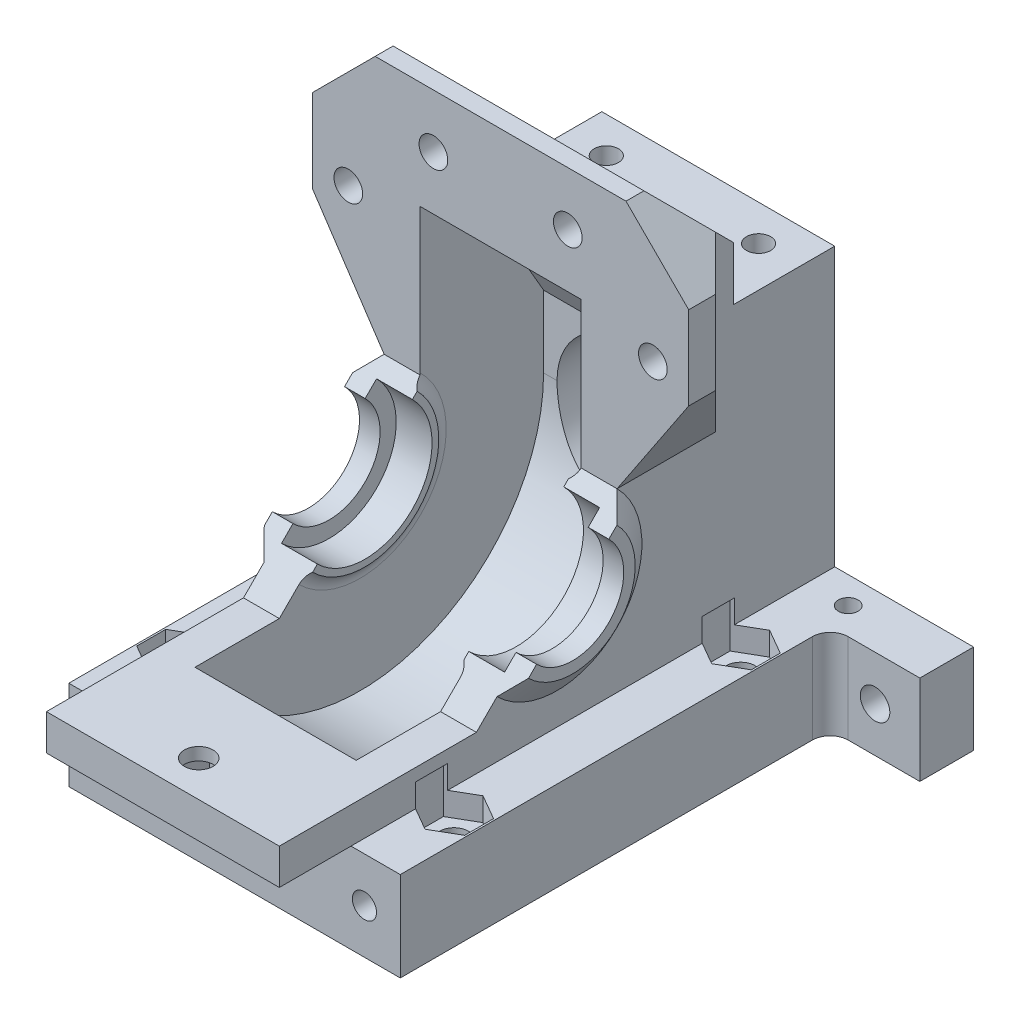
from build123d import *

# Parameters (mm, degrees)
ESQUISSE1_R                          = 1.1
ESQUISSE1_R_2                        = 1.6
BOSS_EXTRU_1_DEPTH                   = 10
BOSS_EXTRU_2_DEPTH                   = 13
BOSS_EXTRU_2_DEPTH_BACK              = 13
BOSS_EXTRU_3_DEPTH                   = 1.75
BOSS_EXTRU_7_DEPTH                   = 11
CHANFREIN2_SIZE                      = 8
ESQUISSE6_R                          = 1.6
ESQUISSE6_R_2                        = 1.65
ENL_V_MAT_EXTRU_3_DEPTH              = 52
ENL_V_MAT_EXTRU_17_DEPTH             = 21.3
ESQUISSE31_R                         = 1.35
ENL_V_MAT_EXTRU_16_DEPTH             = 10
ENL_V_MAT_EXTRU_5_DEPTH              = 2.6
ESQUISSE13_R                         = 1.35
ENL_V_MAT_EXTRU_6_DEPTH              = 8
ENL_V_MAT_EXTRU_7_DEPTH              = 9
ENL_V_MAT_EXTRU_7_DEPTH_BACK         = 9
BOSS_EXTRU_5_REACH                   = 61.593
ENL_V_MAT_EXTRU_8_DEPTH              = 4
CONG_1_R                             = 2
ENL_V_MAT_EXTRU_10_REACH             = 65.853
ESQUISSE21_R                         = 1.6
ENL_V_MAT_EXTRU_11_DEPTH             = 2.6
ESQUISSE30_R                         = 6
ESQUISSE30_R_2                       = 3.5
BOSS_EXTRU_6_DEPTH                   = 3.5
CONG_2_R                             = 3.5
ENL_V_MAT_EXTRU_12_REACH             = 78.689
ESQUISSE25_R                         = 5.1
ENL_V_MAT_EXTRU_12_DIRECTION_2_DEPTH = 2.5
ESQUISSE26_R                         = 7.5
ENL_V_MAT_EXTRU_13_DEPTH             = 5
ENL_V_MAT_EXTRU_13_DIRECTION_2_REACH = 70.48
CHANFREIN3_SIZE2                     = 2.5
CHANFREIN3_SIZE                      = 1.75
CHANFREIN4_SIZE2                     = 1.75
CHANFREIN4_SIZE                      = 2.5
CHANFREIN5_SIZE                      = 10


# Some blends are built 0.0001 mm under size
with BuildPart() as part:
    # Esquisse1 → Boss.-Extru.1 (new body)
    with BuildSketch(Plane(origin=(0, -23, 0), x_dir=(1, 0, 0), z_dir=(0, 1, 0))):
        Polygon((18.5, -23), (-18.5, -23), (-18.5, 25), (-28.5, 25), (-28.5, 31), (28.5, 31), (28.5, 25), (18.5, 25), align=None)
        with Locations(Location((-17.5, 28, 0), (0, 0, 270))):
            Circle(ESQUISSE1_R, mode=Mode.SUBTRACT)
        with Locations(Location((-15.5, 18, 0), (0, 0, 270))):
            Circle(ESQUISSE1_R_2, mode=Mode.SUBTRACT)
        with Locations(Location((-15.5, -14, 0), (0, 0, 270))):
            Circle(ESQUISSE1_R_2, mode=Mode.SUBTRACT)
        with Locations(Location((15.5, -14, 0), (0, 0, 90))):
            Circle(ESQUISSE1_R_2, mode=Mode.SUBTRACT)
        with Locations(Location((15.5, 18, 0), (0, 0, 90))):
            Circle(ESQUISSE1_R_2, mode=Mode.SUBTRACT)
        with Locations(Location((17.5, 28, 0), (0, 0, 90))):
            Circle(ESQUISSE1_R, mode=Mode.SUBTRACT)
    extrude(amount=BOSS_EXTRU_1_DEPTH)

    # Esquisse2 → Boss.-Extru.2 (add, two sides: drawn at the far end of the back side and taken through both)
    with BuildSketch(Plane(origin=(0, 0, 0), x_dir=(0, 0, -1), z_dir=(1, 0, 0)).offset(-BOSS_EXTRU_2_DEPTH_BACK)):
        with BuildLine():
            Line((31, -13), (-31, -13))
            Line((-31, -13), (-31, -9))
            Line((-31, -9), (-9, -9))
            Line((-9, -9), (-4.030508653, -4.030508653))
            ThreePointArc((-4.030508653, -4.030508653), (4.030508653, -4.030508653), (4.030508653, 4.030508653))
            Line((4.030508653, 4.030508653), (6.7, 6.7))
            Line((6.7, 6.7), (6.7, 35))
            Line((6.7, 35), (8.7, 35))
            Line((8.7, 35), (19.7, 24))
            Line((19.7, 24), (19.7, 18))
            Line((19.7, 18), (31, 18))
            Line((31, 18), (31, -13))
        make_face()
    extrude(amount=BOSS_EXTRU_2_DEPTH + BOSS_EXTRU_2_DEPTH_BACK)

    # Esquisse3 → Boss.-Extru.3 (add)
    with BuildSketch(Plane(origin=(13, 0, 0), x_dir=(0, 0, -1), z_dir=(1, 0, 0))):
        with BuildLine():
            Line((-6.7, -6.7), (-4.030508653, -4.030508653))
            ThreePointArc((-4.030508653, -4.030508653), (4.030508653, -4.030508653), (4.030508653, 4.030508653))
            Line((4.030508653, 4.030508653), (6.7, 6.7))
            ThreePointArc((6.7, 6.7), (6.7, -6.7), (-6.7, -6.7))
        make_face()
    boss_extru_3 = extrude(amount=BOSS_EXTRU_3_DEPTH)

    # Esquisse4 → Boss.-Extru.7 (add)
    with BuildSketch(Plane(origin=(19.7, 0, -6.7), x_dir=(-1, 0, 0), z_dir=(0, 0, -1))):
        Polygon((6.7, 6.7), (-1.3, 18.7), (-1.3, 26), (6.7, 26), align=None)
        Polygon((40.7, 18.7), (40.7, 26), (32.7, 26), (32.7, 6.7), align=None)
    extrude(amount=BOSS_EXTRU_7_DEPTH)

    # Chanfrein2
    chanfrein2_edges = [part.edges().sort_by_distance(p)[0] for p in [
        (-21, 22.35, -17.7),
        (21, 22.35, -17.7),
    ]]
    chamfer(chanfrein2_edges, length=CHANFREIN2_SIZE - 0.0001)  # a hair under: the kernel refuses the full size

    # Esquisse6 → Enlèv. mat.-Extru.3 (cut)
    with BuildSketch(Plane.XY.offset(23)):
        with Locations((17, 21)):
            Circle(ESQUISSE6_R)
        with Locations((7.5, 29)):
            Circle(ESQUISSE6_R)
        with Locations((23.5, -18)):
            Circle(ESQUISSE6_R_2)
    enl_v_mat_extru_3 = extrude(amount=-ENL_V_MAT_EXTRU_3_DEPTH, mode=Mode.SUBTRACT)

    # Esquisse7 → Enlèv. mat.-Extru.17 (cut)
    with BuildSketch(Plane(origin=(0, 0, -31), x_dir=(-1, 0, 0), z_dir=(0, 0, -1))):
        Polygon((-14.2, 22.616580754), (-17, 24.233161507), (-19.8, 22.616580754), (-19.8, 19.383419246), (-17, 17.766838493), (-14.2, 19.383419246), align=None)
        Polygon((-4.266838493, 29), (-5.883419246, 31.8), (-9.116580754, 31.8), (-10.733161507, 29), (-9.116580754, 26.2), (-5.883419246, 26.2), align=None)
    enl_v_mat_extru_17 = extrude(amount=-ENL_V_MAT_EXTRU_17_DEPTH, mode=Mode.SUBTRACT)

    # Esquisse31 → Enlèv. mat.-Extru.16 (cut)
    with BuildSketch(Plane.XY.offset(23)):
        with Locations((14.5, -18)):
            Circle(ESQUISSE31_R)
        with Locations(Location((-14.5, -18, 0), (0, 0, 280.628726743))):
            Circle(ESQUISSE31_R)
    enl_v_mat_extru_16 = extrude(amount=-ENL_V_MAT_EXTRU_16_DEPTH, mode=Mode.SUBTRACT)

    # Esquisse9 → Enlèv. mat.-Extru.5 (cut, symmetric)
    with BuildSketch(Plane(origin=(0, -13, 0), x_dir=(1, 0, 0), z_dir=(0, 1, 0))):
        Polygon((18.3, -15.616580754), (18.3, -12.383419246), (15.5, -10.766838493), (12.7, -12.383419246), (12.7, -15.616580754), (15.5, -17.233161507), align=None)
        Polygon((18.3, 19.616580754), (15.5, 21.233161507), (12.7, 19.616580754), (12.7, 16.383419246), (15.5, 14.766838493), (18.3, 16.383419246), align=None)
    enl_v_mat_extru_5 = extrude(amount=ENL_V_MAT_EXTRU_5_DEPTH, both=True, mode=Mode.SUBTRACT)

    # Esquisse13 → Enlèv. mat.-Extru.6 (cut)
    with BuildSketch(Plane(origin=(0, 18, 0), x_dir=(1, 0, 0), z_dir=(0, 1, 0))):
        with Locations(Location((8.5, 27, 0), (0, 0, 270))):
            Circle(ESQUISSE13_R)
    enl_v_mat_extru_6 = extrude(amount=-ENL_V_MAT_EXTRU_6_DEPTH, mode=Mode.SUBTRACT)

    # Esquisse14 → Enlèv. mat.-Extru.7 (cut, two sides: drawn at the far end of the back side and taken through both)
    with BuildSketch(Plane(origin=(0, 0, 0), x_dir=(0, 0, -1), z_dir=(1, 0, 0)).offset(-ENL_V_MAT_EXTRU_7_DEPTH_BACK)):
        with BuildLine():
            Line((20.5, 0), (20.5, 8))
            Line((20.5, 8), (13.57179677, 20))
            Line((13.57179677, 20), (6.7, 23))
            Line((6.7, 23), (6.7, 6.7))
            Line((6.7, 6.7), (4.030508653, 4.030508653))
            ThreePointArc((4.030508653, 4.030508653), (4.030508653, -4.030508653), (-4.030508653, -4.030508653))
            Line((-4.030508653, -4.030508653), (-9, -9))
            Line((-9, -9), (-18.418740456, -9))
            ThreePointArc((-18.418740456, -9), (4.618756361, -19.972908894), (20.5, 0))
        make_face()
    extrude(amount=ENL_V_MAT_EXTRU_7_DEPTH + ENL_V_MAT_EXTRU_7_DEPTH_BACK, mode=Mode.SUBTRACT)

    # Esquisse17 → Boss.-Extru.5 (add, up to next)
    with BuildSketch(Plane(origin=(8.45, 0, 0), x_dir=(0, 0, -1), z_dir=(1, 0, 0)), mode=Mode.PRIVATE) as boss_extru_5_sk1:
        with BuildLine():
            Line((4.030508653, 4.030508653), (5.833630945, 5.833630945))
            ThreePointArc((5.833630945, 5.833630945), (5.833630945, -5.833630945), (-5.833630945, -5.833630945))
            Line((-5.833630945, -5.833630945), (-4.030508653, -4.030508653))
            ThreePointArc((-4.030508653, -4.030508653), (4.030508653, -4.030508653), (4.030508653, 4.030508653))
        make_face()
    boss_extru_5_tool1 = extrude(boss_extru_5_sk1.sketch, amount=BOSS_EXTRU_5_REACH, mode=Mode.PRIVATE) - part.part
    boss_extru_5 = boss_extru_5_tool1.solids().sort_by_distance((8.45, -5.072906, 4.791233))[0]
    add(boss_extru_5)

    # Esquisse18 → Enlèv. mat.-Extru.8 (cut)
    with BuildSketch(Plane.ZY.offset(-8.45)):
        with BuildLine():
            Line((-5.303300859, 5.303300859), (5.303300859, -5.303300859))
            ThreePointArc((5.303300859, -5.303300859), (-5.303300859, -5.303300859), (-5.303300859, 5.303300859))
        make_face()
    enl_v_mat_extru_8 = extrude(amount=-ENL_V_MAT_EXTRU_8_DEPTH, mode=Mode.SUBTRACT)

    # Symétrie1: Boss.-Extru.3, Enlèv. mat.-Extru.3, Enlèv. mat.-Extru.17, Enlèv. mat.-Extru.16, Enlèv. mat.-Extru.5, Enlèv. mat.-Extru.6, Boss.-Extru.5, Enlèv. mat.-Extru.8 across plane
    add(boss_extru_3.mirror(Plane(origin=(0, 0, 0), x_dir=(0, 0, 1), z_dir=(1, 0, 0))))
    add(enl_v_mat_extru_3.mirror(Plane(origin=(0, 0, 0), x_dir=(0, 0, 1), z_dir=(1, 0, 0))), mode=Mode.SUBTRACT)
    add(enl_v_mat_extru_17.mirror(Plane(origin=(0, 0, 0), x_dir=(0, 0, 1), z_dir=(1, 0, 0))), mode=Mode.SUBTRACT)
    add(enl_v_mat_extru_16.mirror(Plane(origin=(0, 0, 0), x_dir=(0, 0, 1), z_dir=(1, 0, 0))), mode=Mode.SUBTRACT)
    add(enl_v_mat_extru_5.mirror(Plane(origin=(0, 0, 0), x_dir=(0, 0, 1), z_dir=(1, 0, 0))), mode=Mode.SUBTRACT)
    add(enl_v_mat_extru_6.mirror(Plane(origin=(0, 0, 0), x_dir=(0, 0, 1), z_dir=(1, 0, 0))), mode=Mode.SUBTRACT)
    add(boss_extru_5.mirror(Plane(origin=(0, 0, 0), x_dir=(0, 0, 1), z_dir=(1, 0, 0))))
    add(enl_v_mat_extru_8.mirror(Plane(origin=(0, 0, 0), x_dir=(0, 0, 1), z_dir=(1, 0, 0))), mode=Mode.SUBTRACT)

    # Congé1
    # the kernel refuses this fillet: 2 mm, written as the material it adds along each edge
    with BuildSketch(Plane(origin=(9, 0, 0), x_dir=(0, 0.7071067811865466, -0.7071067811865485), z_dir=(0, 0.7071067811865485, 0.7071067811865466))) as cong_1_piece_1:
        with BuildLine():
            CenterArc((9.627497731, 2), CONG_1_R, 226.468847833, 43.531152167)
            Line((8.25, 0.55), (8.25, 0))
            Line((8.25, 0), (9.627497731, 0))
        make_face()
    revolve(axis=Axis((9, 0, 0), (-1, 0, 0)), revolution_arc=180)
    with BuildSketch(Plane(origin=(9, 0, 0), x_dir=(0, 0.9332991182686485, -0.3590999245877991), z_dir=(0, 0.3590999245877991, 0.9332991182686485))) as cong_1_piece_2_section:
        with BuildLine():
            CenterArc((9.627497731, 2), CONG_1_R, 226.468847833, 43.531152167)
            Line((8.25, 0.55), (8.25, 0))
            Line((8.25, 0), (9.627497731, 0))
        make_face()
    cong_1_piece_2 = revolve(axis=Axis((9, 0, 0), (-1, 0, 0)), revolution_arc=227.910140794, mode=Mode.PRIVATE)
    cong_1_piece_2 = split(cong_1_piece_2, bisect_by=Plane(origin=(9, 0, -6.7), z_dir=(0, 0, -1)), keep=Keep.TOP, mode=Mode.PRIVATE)
    add(cong_1_piece_2)
    with BuildSketch(Plane(origin=(-9, 0, 0), x_dir=(0, 0.7071067811865466, -0.7071067811865485), z_dir=(0, 0.7071067811865485, 0.7071067811865466))) as cong_1_piece_3:
        with BuildLine():
            CenterArc((9.627497731, -2), CONG_1_R, 90, 43.531152167)
            Line((8.25, -0.55), (8.25, 0))
            Line((8.25, 0), (9.627497731, 0))
        make_face()
    revolve(axis=Axis((-9, 0, 0), (-1, 0, 0)), revolution_arc=180)
    with BuildSketch(Plane(origin=(-9, 0, 0), x_dir=(0, 0.9332991182686485, -0.3590999245877991), z_dir=(0, 0.3590999245877991, 0.9332991182686485))) as cong_1_piece_4_section:
        with BuildLine():
            CenterArc((9.627497731, -2), CONG_1_R, 90, 43.531152167)
            Line((8.25, -0.55), (8.25, 0))
            Line((8.25, 0), (9.627497731, 0))
        make_face()
    cong_1_piece_4 = revolve(axis=Axis((-9, 0, 0), (-1, 0, 0)), revolution_arc=227.910140794, mode=Mode.PRIVATE)
    cong_1_piece_4 = split(cong_1_piece_4, bisect_by=Plane(origin=(-9, 0, -6.7), z_dir=(0, 0, -1)), keep=Keep.TOP, mode=Mode.PRIVATE)
    add(cong_1_piece_4)
    with BuildSketch(Plane(origin=(18.5, -23, -25), x_dir=(1, 0, 0), z_dir=(0, 1, 0)), Plane(origin=(-18.5, -23, -25), x_dir=(0, 0, 1), z_dir=(0, 1, 0))) as cong_1_piece_5:
        with BuildLine():
            CenterArc((CONG_1_R, -CONG_1_R), CONG_1_R, 90, 90)
            Line((0, -CONG_1_R), (0, 0))
            Line((0, 0), (CONG_1_R, 0))
        make_face()
    extrude(amount=10)

    # Esquisse21 → Enlèv. mat.-Extru.10 (cut, up to next)
    with BuildSketch(Plane.XZ.offset(13), mode=Mode.PRIVATE) as enl_v_mat_extru_10_sk1:
        with Locations(Location((0, 27, 0), (0, 0, 270))):
            Circle(ESQUISSE21_R)
    enl_v_mat_extru_10_tool1 = extrude(enl_v_mat_extru_10_sk1.sketch, amount=-ENL_V_MAT_EXTRU_10_REACH, mode=Mode.PRIVATE) & part.part
    add(enl_v_mat_extru_10_tool1.solids().sort_by_distance((0, -13, 27))[0], mode=Mode.SUBTRACT)

    # Esquisse22 → Enlèv. mat.-Extru.11 (cut)
    with BuildSketch(Plane.XZ.offset(13)):
        Polygon((3.233161507, 27), (1.616580754, 29.8), (-1.616580754, 29.8), (-3.233161507, 27), (-1.616580754, 24.2), (1.616580754, 24.2), align=None)
    extrude(amount=-ENL_V_MAT_EXTRU_11_DEPTH, mode=Mode.SUBTRACT)

    # Esquisse30 → Boss.-Extru.6 (add)
    with BuildSketch(Plane(origin=(0, 0, -31), x_dir=(-1, 0, 0), z_dir=(0, 0, -1))):
        with Locations(Location((0, 0, 0), (0, 0, 180))):
            Circle(ESQUISSE30_R)
        Circle(ESQUISSE30_R_2, mode=Mode.SUBTRACT)
    extrude(amount=BOSS_EXTRU_6_DEPTH)

    # Congé2
    cong_2_edges = [part.edges().sort_by_distance(p)[0] for p in [
        (-6, 0, -31),
    ]]
    fillet(cong_2_edges, radius=CONG_2_R - 0.0001)  # a hair under: the kernel refuses the full size

    # Esquisse25 → Enlèv. mat.-Extru.12 (cut, up to next)
    with BuildSketch(Plane(origin=(0, 0, -31), x_dir=(-1, 0, 0), z_dir=(0, 0, -1)), mode=Mode.PRIVATE) as enl_v_mat_extru_12_sk1:
        Circle(ESQUISSE25_R)
    enl_v_mat_extru_12_tool1 = extrude(enl_v_mat_extru_12_sk1.sketch, amount=-ENL_V_MAT_EXTRU_12_REACH, mode=Mode.PRIVATE) & part.part
    add(enl_v_mat_extru_12_tool1.solids().sort_by_distance((0, 0, -31))[0], mode=Mode.SUBTRACT)

    # Esquisse25 → Enlèv. mat.-Extru.12 direction 2 (cut)
    with BuildSketch(Plane(origin=(0, 0, -31), x_dir=(-1, 0, 0), z_dir=(0, 0, -1))):
        Circle(ESQUISSE25_R)
    extrude(amount=ENL_V_MAT_EXTRU_12_DIRECTION_2_DEPTH, mode=Mode.SUBTRACT)

    # Esquisse26 → Enlèv. mat.-Extru.13 (cut)
    with BuildSketch(Plane.XY.offset(-20.5)):
        Circle(ESQUISSE26_R)
    extrude(amount=-ENL_V_MAT_EXTRU_13_DEPTH, mode=Mode.SUBTRACT)

    # Esquisse26 → Enlèv. mat.-Extru.13 direction 2 (cut, up to next)
    with BuildSketch(Plane.XY.offset(-20.5), mode=Mode.PRIVATE) as enl_v_mat_extru_13_direction_2_sk1:
        Circle(ESQUISSE26_R)
    enl_v_mat_extru_13_direction_2_tool1 = extrude(enl_v_mat_extru_13_direction_2_sk1.sketch, amount=ENL_V_MAT_EXTRU_13_DIRECTION_2_REACH, mode=Mode.PRIVATE) & part.part
    add(enl_v_mat_extru_13_direction_2_tool1.solids().sort_by_distance((0, 0, -20.5))[0], mode=Mode.SUBTRACT)

    # Chanfrein3
    chanfrein3_edges = [part.edges().sort_by_distance(p)[0] for p in [
        (14.75, -6.7, -6.7),
    ]]
    chanfrein3_side = [part.faces().sort_by_distance(p)[0] for p in [
        (14.715, -6.7, -6.7),
    ]]
    chamfer(chanfrein3_edges, length=CHANFREIN3_SIZE - 0.0001, length2=CHANFREIN3_SIZE2 - 0.0001, reference=chanfrein3_side[0])  # a hair under: the kernel refuses the full size

    # Chanfrein4
    chanfrein4_edges = [part.edges().sort_by_distance(p)[0] for p in [
        (-14.75, -6.7, -6.7),
    ]]
    chanfrein4_side = [part.faces().sort_by_distance(p)[0] for p in [
        (-14.75, -6.675251263, -6.675251263),
    ]]
    chamfer(chanfrein4_edges, length=CHANFREIN4_SIZE - 0.0001, length2=CHANFREIN4_SIZE2 - 0.0001, reference=chanfrein4_side[0])  # a hair under: the kernel refuses the full size

    # Chanfrein5
    # the kernel refuses this chamfer: 10 mm, written as the material it adds along each edge
    with BuildSketch(Plane(origin=(13, 26, -6.7), x_dir=(0, 1, 0), z_dir=(0, 0, -1))) as chanfrein5_piece_1_section:
        Polygon((CHANFREIN5_SIZE, 0), (0, CHANFREIN5_SIZE), (0, 0), align=None)
    chanfrein5_piece_1 = extrude(amount=36.71682988, mode=Mode.PRIVATE)
    chanfrein5_piece_1 = split(chanfrein5_piece_1, bisect_by=Plane(origin=(13, 35, -6.7), z_dir=(0, -1, 0)), keep=Keep.TOP, mode=Mode.PRIVATE)
    chanfrein5_piece_1 = split(chanfrein5_piece_1, bisect_by=Plane(origin=(21, 26, -6.7), z_dir=(-1, 0, 0)), keep=Keep.TOP, mode=Mode.PRIVATE)
    chanfrein5_piece_1 = split(chanfrein5_piece_1, bisect_by=Plane(origin=(13, 31.5, -12.2), z_dir=(0, -0.7071067811865491, 0.7071067811865459)), keep=Keep.TOP, mode=Mode.PRIVATE)
    chanfrein5_piece_1 = split(chanfrein5_piece_1, bisect_by=Plane(origin=(18.50005, 26, -12.20005), z_dir=(-0.7071067811865476, 0, 0.7071067811865476)), keep=Keep.TOP, mode=Mode.PRIVATE)
    add(chanfrein5_piece_1)
    with BuildSketch(Plane(origin=(-13, 26, -6.7), x_dir=(-1, 0, 0), z_dir=(0, 0, -1))) as chanfrein5_piece_2_section:
        Polygon((CHANFREIN5_SIZE, 0), (0, CHANFREIN5_SIZE), (0, 0), align=None)
    chanfrein5_piece_2 = extrude(amount=36.71682988, mode=Mode.PRIVATE)
    chanfrein5_piece_2 = split(chanfrein5_piece_2, bisect_by=Plane(origin=(-21, 26, -6.7), z_dir=(1, 0, 0)), keep=Keep.TOP, mode=Mode.PRIVATE)
    chanfrein5_piece_2 = split(chanfrein5_piece_2, bisect_by=Plane(origin=(-13, 35, -6.7), z_dir=(0, -1, 0)), keep=Keep.TOP, mode=Mode.PRIVATE)
    chanfrein5_piece_2 = split(chanfrein5_piece_2, bisect_by=Plane(origin=(-13, 31.5, -12.2), z_dir=(0, -0.7071067811865491, 0.7071067811865459)), keep=Keep.TOP, mode=Mode.PRIVATE)
    chanfrein5_piece_2 = split(chanfrein5_piece_2, bisect_by=Plane(origin=(-18.50005, 26, -12.20005), z_dir=(0.7071067811865476, 0, 0.7071067811865476)), keep=Keep.TOP, mode=Mode.PRIVATE)
    add(chanfrein5_piece_2)


solid = part.part
